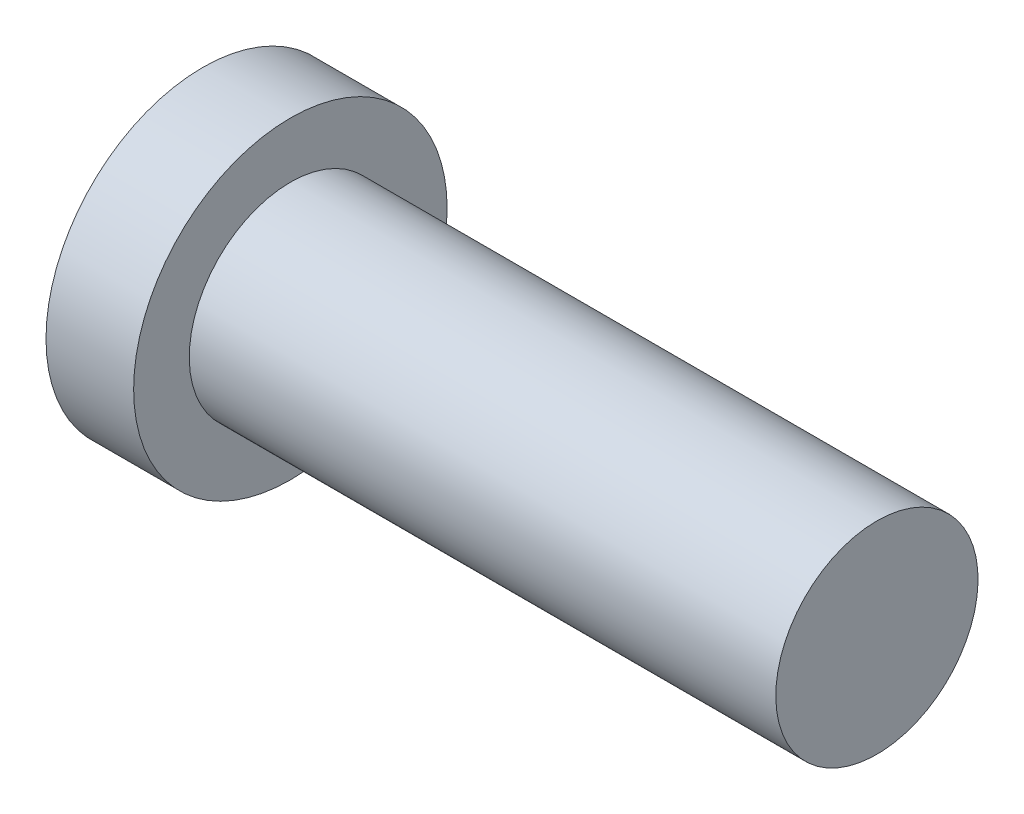
from build123d import *


with BuildPart() as part:
    # Sketch1 → Revolve1 (revolve)
    with BuildSketch(Plane(origin=(-21.063200938, 25.610188417, 0), x_dir=(0, -1, 0), z_dir=(0, 0, 1))):
        with BuildLine():
            Line((25.610188417, 21.063200938), (26.000188417, 21.063200938))
            Line((26.000188417, 21.063200938), (26.000188417, 21.354593867))
            ThreePointArc((26.000188417, 21.354593867), (26.068255039, 21.531913477), (26.237488375, 21.618142169))
            Line((26.237488375, 21.618142169), (27.935188417, 21.796577634))
            Line((27.935188417, 21.796577634), (27.935188417, 23.096577634))
            Line((27.935188417, 23.096577634), (27.110188417, 23.096577634))
            Line((27.110188417, 23.096577634), (27.110188417, 31.796577634))
            Line((27.110188417, 31.796577634), (25.610188417, 31.796577634))
            Line((25.610188417, 31.796577634), (25.610188417, 21.063200938))
        make_face()
    revolve(axis=Axis((28.987368623, 0, 0), (-1, 0, 0)))


solid = part.part
